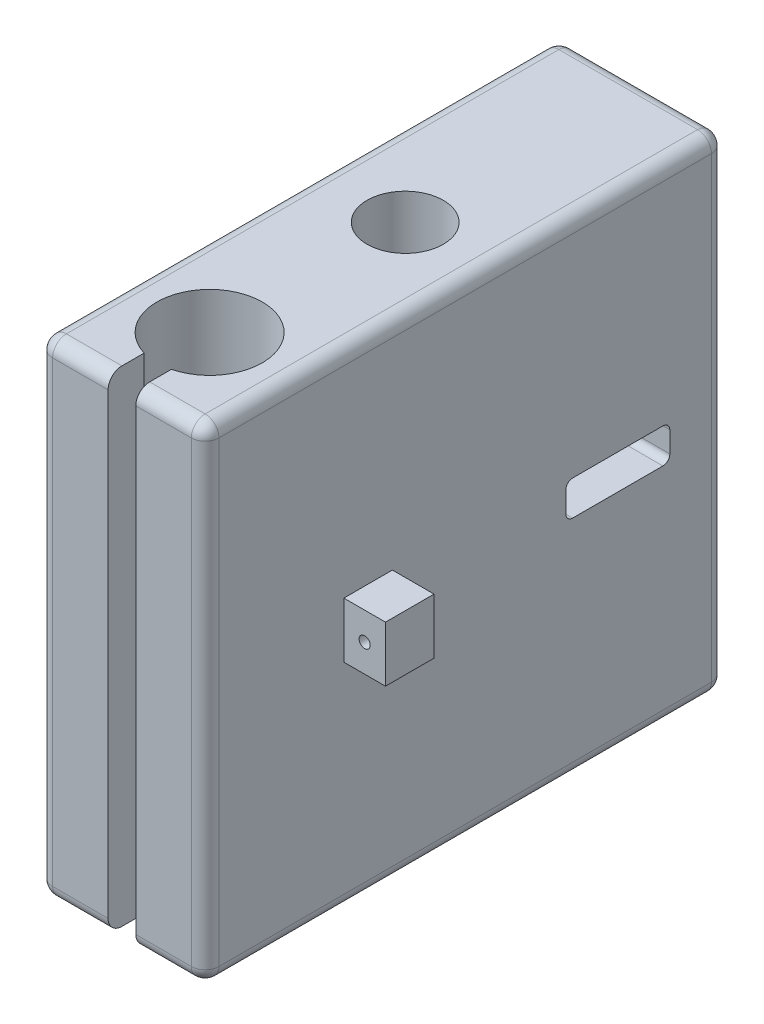
from build123d import *

# Parameters (mm, degrees)
RESSALTO_EXTRUS_O1_DEPTH                   = 12
RESSALTO_EXTRUS_O1_DEPTH_BACK              = 12
ESBO_O1_W                                  = 75
ESBO_O1_H                                  = 70
ESBO_O3_R                                  = 5.5
CORTE_EXTRUS_O1_DEPTH                      = 525.799189678
ESBO_O4_R                                  = 4.1
CORTE_EXTRUS_O2_DEPTH                      = 20
FILETE1_R                                  = 2
CORTE_EXTRUS_O3_DEPTH                      = 29
CORTE_EXTRUS_O4_DEPTH                      = 28
RESSALTO_EXTRUS_O2_DEPTH                   = 6
RESSALTO_EXTRUS_O2_DEPTH_BACK              = 30
ESBO_O7_W                                  = 7
ESBO_O7_H                                  = 8
BROCA_DE_ROSQUEAR_PARA_TARRAXA_DE_M2X0_4_D = 1.6
BROCA_DE_ROSQUEAR_PARA_TARRAXA_DE_M2_2_D   = 1.6


with BuildPart() as part:
    # Esboço1 → Ressalto-extrusão1 (new, two sides: drawn at the far end of the back side and taken through both)
    with BuildSketch(Plane(origin=(-220, 0, 0), x_dir=(0, 0, -1), z_dir=(1, 0, 0)).offset(-RESSALTO_EXTRUS_O1_DEPTH_BACK)):
        with Locations((-427.999935002, 213.253952806)):
            Rectangle(ESBO_O1_W, ESBO_O1_H)
    extrude(amount=RESSALTO_EXTRUS_O1_DEPTH + RESSALTO_EXTRUS_O1_DEPTH_BACK)

    # Esboço3 → Corte-extrusão1 (cut, through all)
    with BuildSketch(Plane(origin=(0, 248.253952806, 0), x_dir=(1, 0, 0), z_dir=(0, 1, 0))):
        with Locations((-219.508549322, -425.149935105)):
            Circle(ESBO_O3_R)
        with BuildLine():
            Line((-220, -465.499935002), (-218, -465.499935002))
            Line((-218, -465.499935002), (-218, -460.369179456))
            ThreePointArc((-218, -460.369179456), (-219.711945476, -445.401349285), (-222, -460.292000844))
            Line((-222, -460.292000844), (-222, -465.499935002))
            Line((-222, -465.499935002), (-220, -465.499935002))
        make_face()
    extrude(amount=-CORTE_EXTRUS_O1_DEPTH, mode=Mode.SUBTRACT)

    # Esboço4 → Corte-extrusão2 (cut)
    with BuildSketch(Plane(origin=(0, 0, 390.499935002), x_dir=(-1, 0, 0), z_dir=(0, 0, -1))):
        with Locations((219.858557552, 238.253952806)):
            Circle(ESBO_O4_R)
        with Locations((219.858557552, 188.253952806)):
            Circle(ESBO_O4_R)
    extrude(amount=-CORTE_EXTRUS_O2_DEPTH, mode=Mode.SUBTRACT)

    # Filete1
    filete1_edges = [part.edges().sort_by_distance(p)[0] for p in [
        (-227, 178.253952806, 465.499935002),
        (-213, 178.253952806, 465.499935002),
        (-213, 248.253952806, 465.499935002),
        (-227, 248.253952806, 465.499935002),
        (-208, 178.253952806, 427.999935002),
        (-208, 248.253952806, 427.999935002),
        (-208, 213.253952806, 465.499935002),
        (-232, 178.253952806, 427.999935002),
        (-232, 213.253952806, 465.499935002),
        (-232, 248.253952806, 427.999935002),
        (-220, 248.253952806, 390.499935002),
        (-220, 178.253952806, 390.499935002),
        (-208, 213.253952806, 390.499935002),
        (-232, 213.253952806, 390.499935002),
    ]]
    fillet(filete1_edges, radius=FILETE1_R)

    # Esboço5 → Corte-extrusão3 (cut)
    with BuildSketch(Plane(origin=(0, 0, 390.499935002), x_dir=(-1, 0, 0), z_dir=(0, 0, -1))):
        Polygon((213.892971775, 195.258835849), (225.892967746, 195.249001642), (225.922470366, 231.248989554), (213.922474396, 231.25882376), align=None)
    extrude(amount=-CORTE_EXTRUS_O3_DEPTH, mode=Mode.SUBTRACT)

    # Esboço6 → Corte-extrusão4 (cut)
    with BuildSketch(Plane.ZY.offset(232)):
        with BuildLine():
            Line((399.499935002, 215.753952806), (412.499935002, 215.753952806))
            ThreePointArc((412.499935002, 215.753952806), (413.207041783, 215.461059587), (413.499935002, 214.753952806))
            Line((413.499935002, 214.753952806), (413.499935002, 211.753952806))
            ThreePointArc((413.499935002, 211.753952806), (413.207041783, 211.046846025), (412.499935002, 210.753952806))
            Line((412.499935002, 210.753952806), (399.499935002, 210.753952806))
            ThreePointArc((399.499935002, 210.753952806), (398.792828221, 211.046846025), (398.499935002, 211.753952806))
            Line((398.499935002, 211.753952806), (398.499935002, 214.753952806))
            ThreePointArc((398.499935002, 214.753952806), (398.792828221, 215.461059587), (399.499935002, 215.753952806))
        make_face()
    extrude(amount=-CORTE_EXTRUS_O4_DEPTH, mode=Mode.SUBTRACT)

    # Esboço7 → Ressalto-extrusão2 (add, two sides: drawn at the far end of the back side and taken through both)
    with BuildSketch(Plane(origin=(-208, 0, 0), x_dir=(0, 0, -1), z_dir=(1, 0, 0)).offset(-RESSALTO_EXTRUS_O2_DEPTH_BACK)):
        with Locations((-441.999935002, 213.253952806)):
            Rectangle(ESBO_O7_W, ESBO_O7_H)
    extrude(amount=RESSALTO_EXTRUS_O2_DEPTH + RESSALTO_EXTRUS_O2_DEPTH_BACK)

    # Broca de rosquear para tarraxa de M2x0.4 (through all)
    with Locations(Plane.XY.offset(445.499935002)):
        with Locations((-205, 213.253952806)):
            Hole(BROCA_DE_ROSQUEAR_PARA_TARRAXA_DE_M2X0_4_D / 2)

    # Broca de rosquear para tarraxa de M2 2 (through all)
    with Locations(Plane.XY.offset(445.499935002)):
        with Locations((-235, 213.253952806)):
            Hole(BROCA_DE_ROSQUEAR_PARA_TARRAXA_DE_M2_2_D / 2)


solid = part.part
